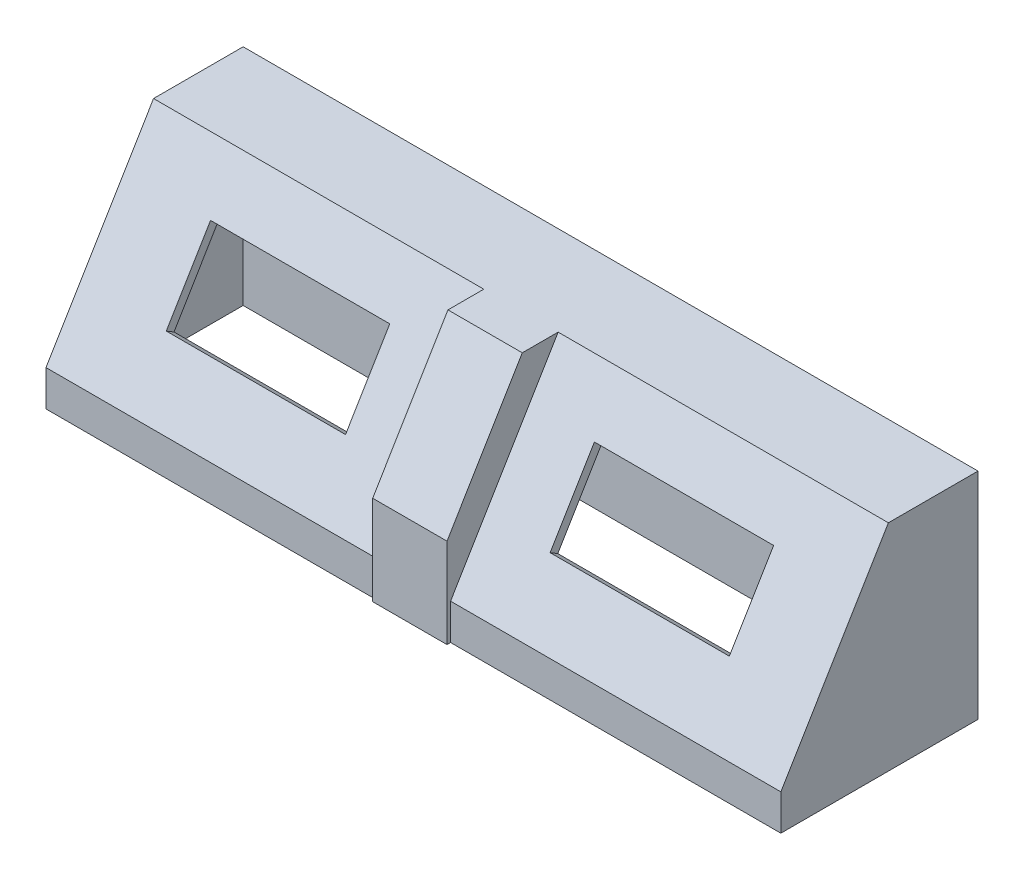
from build123d import *

# Parameters (mm, degrees)
BOSS_EXTRUDE1_DEPTH = 127
BOSS_EXTRUDE2_DEPTH = 3.175
SKETCH3_W           = 63.5
SKETCH3_H           = 30.48
CUT_EXTRUDE1_DEPTH  = 3.175
BOSS_EXTRUDE3_START = -13.167941481
BOSS_EXTRUDE3_DEPTH = 26.335882962
SKETCH10_W          = 26.335882962
SKETCH10_H          = 12.7
BOSS_EXTRUDE5_DEPTH = 31.75
CUT_EXTRUDE7_START  = -10.627941481
CUT_EXTRUDE7_DEPTH  = 21.255882962
CUT_EXTRUDE8_START  = -2.54
SKETCH12_W          = 21.255882962
SKETCH12_H          = 31.75
CUT_EXTRUDE8_DEPTH  = 15.24
CUT_EXTRUDE9_START  = -26.335883
CUT_EXTRUDE9_DEPTH  = 26.335883


# Read off the part's stored shape, not the designer's step: Boss-Extrude3, Cut-Extrude7
with BuildPart() as part:
    # Sketch1 → Boss-Extrude1 (new, symmetric)
    with BuildSketch(Plane(origin=(0, 0, 0), x_dir=(0, 0, -1), z_dir=(1, 0, 0))):
        Polygon((-3.175, 0), (0, 0), (0, 76.2), (-31.75, 76.2), (-69.85, 12.7), (-69.85, 0), (-66.675, 0), (-66.675, 11.820575911), (-29.952345547, 73.025), (-3.175, 73.025), align=None)
    extrude(amount=BOSS_EXTRUDE1_DEPTH, both=True)

    # Sketch2 → Boss-Extrude2 (add)
    with BuildSketch(Plane(origin=(127, 0, 0), x_dir=(0, 0, -1), z_dir=(1, 0, 0))):
        Polygon((-66.675, 0), (-3.175, 0), (-3.175, 73.025), (-29.952345547, 73.025), (-66.675, 11.820575911), align=None)
        Polygon((-66.675, 11.820575911), (-29.952345547, 73.025), (-3.175, 73.025), (-3.175, 0), (0, 0), (0, 76.2), (-31.75, 76.2), (-69.85, 12.7), (-69.85, 0), (-66.675, 0), align=None)
    boss_extrude2 = extrude(amount=BOSS_EXTRUDE2_DEPTH)

    # Mirror1: Boss-Extrude2 across plane
    add(boss_extrude2.mirror(Plane(origin=(0, 0, 0), x_dir=(0, 0, 1), z_dir=(1, 0, 0))))

    # Sketch3 → Cut-Extrude1 (cut)
    with BuildSketch(Plane(origin=(0, 34.177941176, 56.963235294), x_dir=(1, 0, 0), z_dir=(0, 0.5144957554275267, 0.8574929257125442))):
        with Locations((-67.993455951, 13.879941606)):
            Rectangle(SKETCH3_W, SKETCH3_H)
        with Locations((67.993455951, 13.879941606)):
            Rectangle(SKETCH3_W, SKETCH3_H)
    extrude(amount=-CUT_EXTRUDE1_DEPTH, mode=Mode.SUBTRACT)

    # Boss-Extrude3 outline → Boss-Extrude3 (add)
    with BuildSketch(Plane.YZ.offset(BOSS_EXTRUDE3_START)):
        Polygon((76.2, 31.75), (76.2, 44.45), (31.75, 71.12), (31.75, 58.42), align=None)
    extrude(amount=BOSS_EXTRUDE3_DEPTH)

    # Sketch10 → Boss-Extrude5 (add)
    with BuildSketch(Plane.XZ.offset(-31.75)):
        with Locations((0, 64.77)):
            Rectangle(SKETCH10_W, SKETCH10_H)
    extrude(amount=BOSS_EXTRUDE5_DEPTH)

    # Cut-Extrude7 outline → Cut-Extrude7 (cut)
    with BuildSketch(Plane.YZ.offset(CUT_EXTRUDE7_START)):
        Polygon((31.75, 54.717345547), (73.025, 29.952345547), (73.025, 42.652345547), (31.75, 67.417345547), align=None)
    extrude(amount=CUT_EXTRUDE7_DEPTH, mode=Mode.SUBTRACT)

    # Sketch12 → Cut-Extrude8 (cut)
    with BuildSketch(Plane.XY.offset(71.12).offset(CUT_EXTRUDE8_START)):
        with Locations((0, 15.875)):
            Rectangle(SKETCH12_W, SKETCH12_H)
    extrude(amount=-CUT_EXTRUDE8_DEPTH, mode=Mode.SUBTRACT)

    # Sketch13 → Cut-Extrude9 (cut)
    with BuildSketch(Plane(origin=(13.167941481, 0, 0), x_dir=(0, 0, -1), z_dir=(1, 0, 0)).offset(CUT_EXTRUDE9_START)):
        Polygon((-58.42, 25.578909245), (-66.675, 11.820575911), (-66.675, 0), (-58.42, 0), align=None)
    extrude(amount=CUT_EXTRUDE9_DEPTH, mode=Mode.SUBTRACT)


solid = part.part
